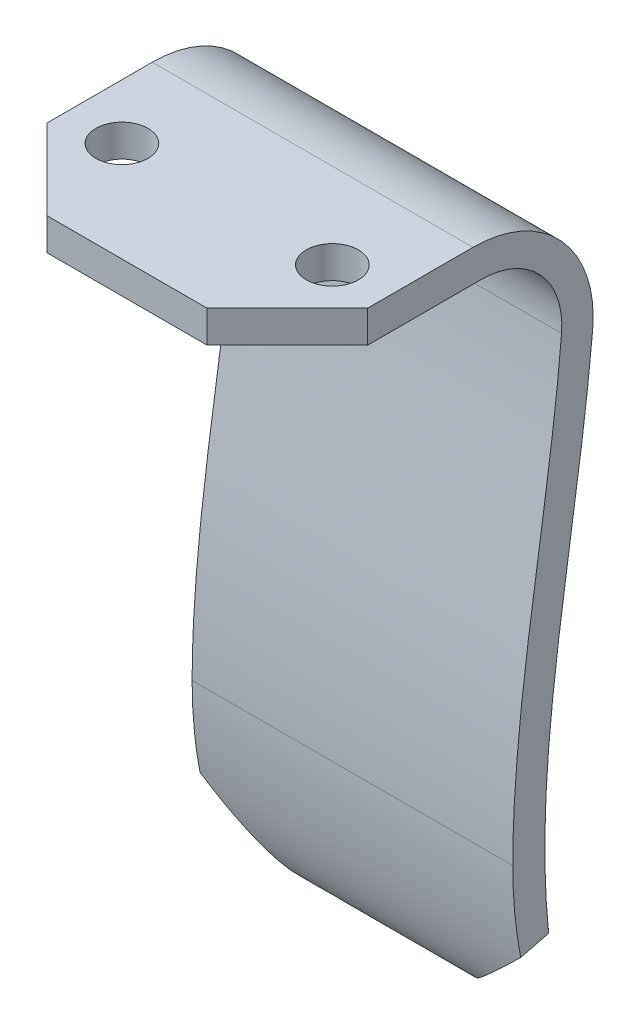
from build123d import *

# Parameters (mm, degrees)
BOSS_EXTRUDE1_DEPTH = 10
CHAMFER1_SIZE       = 5
FILLET1_R           = 5
FILLET2_R           = 7.5
FILLET3_START       = -10
FILLET3_DEPTH       = 20
SKETCH3_R           = 1.625
CUT_EXTRUDE1_DEPTH  = 56.272426005


with BuildPart() as part:
    # Sketch1 → Boss-Extrude1 (new, symmetric)
    with BuildSketch(Plane(origin=(0, 0, 0), x_dir=(0, 0, -1), z_dir=(1, 0, 0))):
        with BuildLine():
            Line((12.319127455, 26), (29.663517642, 26))
            add(Edge.make_bspline(
                [(29.663517642, 26), (29.663517642, 11.740150088), (24.016025287, -2.621570193), (27.532919864, -16.837766109)],
                knots=[0, 0, 0, 0, 1, 1, 1, 1], degree=3))
            Line((27.532919864, -16.837766109), (29.474392891, -16.357471943))
            add(Edge.make_bspline(
                [(31.663517642, 26), (31.663517642, 24.15939465), (31.480704272, 20.46991898), (30.636833768, 13.199740185), (29.144724775, 4.252426008), (28.234715818, -4.480702376), (28.494687407, -11.300478686), (29.06335364, -14.695945165), (29.474392891, -16.357471943)],
                knots=[0, 0, 0, 0, 0.125, 0.25, 0.5, 0.75, 0.875, 1, 1, 1, 1], degree=3))
            Line((31.663517642, 26), (31.663517642, 28))
            Line((31.663517642, 28), (29.663517642, 28))
            Line((29.663517642, 28), (12.319127455, 28))
            Line((12.319127455, 28), (12.319127455, 26))
        make_face()
    extrude(amount=BOSS_EXTRUDE1_DEPTH, both=True)

    # Chamfer1
    chamfer1_edges = [part.edges().sort_by_distance(p)[0] for p in [
        (10, -16.597619026, -28.503656378),
        (-10, -16.597619026, -28.503656378),
        (-10, 27, -12.319127455),
        (10, 27, -12.319127455),
    ]]
    chamfer(chamfer1_edges, length=CHAMFER1_SIZE)

    # Fillet1
    fillet1_edges = [part.edges().sort_by_distance(p)[0] for p in [
        (-5, 26, -29.663517642),
    ]]
    fillet(fillet1_edges, radius=FILLET1_R)

    # Fillet2
    fillet2_edges = [part.edges().sort_by_distance(p)[0] for p in [
        (0, 28, -31.663517642),
    ]]
    fillet(fillet2_edges, radius=FILLET2_R)

    # Fillet3: read off the stored shape, not the designer's step
    # Fillet3 outline → Fillet3 (cut)
    with BuildSketch(Plane.YZ.offset(FILLET3_START)):
        with BuildLine():
            Line((-16.837766109, -27.532919864), (-16.357471943, -29.474392891))
            add(Edge.make_bspline(
                [(-16.357471943, -29.474392891), (-17.106538204, -26.368974262), (-6.635525171, -26.379518895)],
                knots=[0, 0, 0, 1, 1, 1], degree=2, weights=[1, 0.618277336, 1]))
            add(Edge.make_bspline(
                [(-6.635525171, -26.379518895), (-10.042321147, -26.376088146), (-13.444189865, -26.693395004), (-16.837766109, -27.532919864)],
                knots=[0.761288022, 0.761288022, 0.761288022, 0.761288022, 1, 1, 1, 1], degree=3))
        make_face()
    extrude(amount=FILLET3_DEPTH, mode=Mode.SUBTRACT)

    # Sketch3 → Cut-Extrude1 (cut, through all)
    with BuildSketch(Plane(origin=(0, 28, 0), x_dir=(1, 0, 0), z_dir=(0, 1, 0))):
        with Locations(Location((-6.562054303, 18.563874533, 0), (0, 0, 270))):
            Circle(SKETCH3_R)
        with Locations(Location((6.562054303, 18.563874533, 0), (0, 0, 270))):
            Circle(SKETCH3_R)
    extrude(amount=-CUT_EXTRUDE1_DEPTH, mode=Mode.SUBTRACT)


solid = part.part
